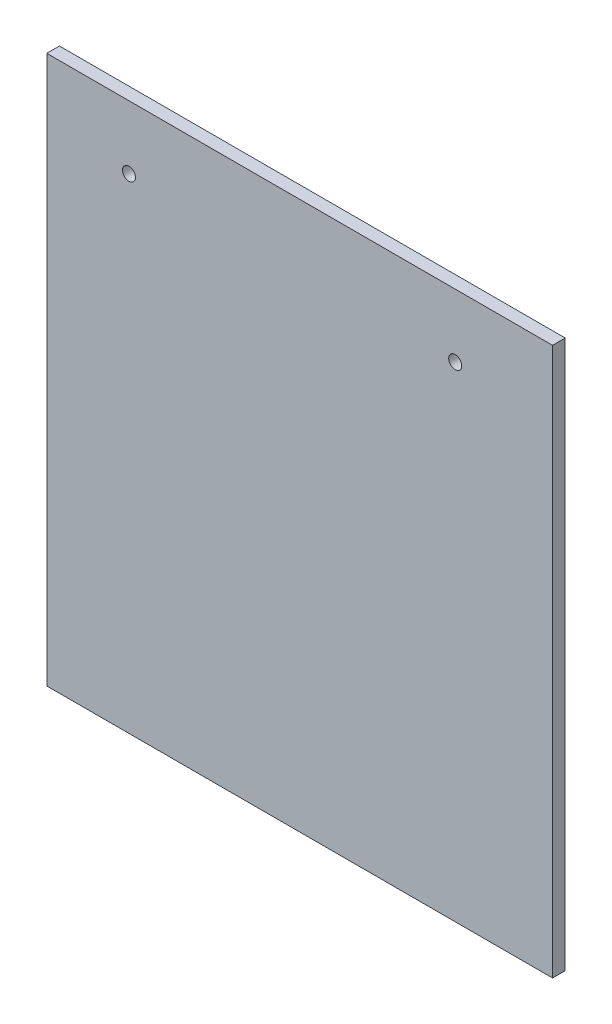
from build123d import *

# Parameters (mm, degrees)
SKETCH_1_W          = 120
SKETCH_1_H          = 130
EXTRUDE_1_DEPTH     = 3
SKETCH_5_R          = 1.55
CUT_EXTRUDE_3_DEPTH = 89.509886453
SKETCH_6_R          = 1.55
CUT_EXTRUDE_4_DEPTH = 89.509886453


with BuildPart() as part:
    # 草图1 → 凸台-拉伸1 (new body)
    with BuildSketch(Plane.XY):
        Rectangle(SKETCH_1_W, SKETCH_1_H)
    extrude(amount=EXTRUDE_1_DEPTH)

    # 草图5 → 切除-拉伸3 (cut, through all)
    with BuildSketch(Plane.XY.offset(3)):
        with Locations((36.9, 50)):
            Circle(SKETCH_5_R)
    extrude(amount=-CUT_EXTRUDE_3_DEPTH, mode=Mode.SUBTRACT)

    # 草图6 → 切除-拉伸4 (cut, through all)
    with BuildSketch(Plane.XY.offset(3)):
        with Locations((-40.5, 50)):
            Circle(SKETCH_6_R)
    extrude(amount=-CUT_EXTRUDE_4_DEPTH, mode=Mode.SUBTRACT)


solid = part.part
